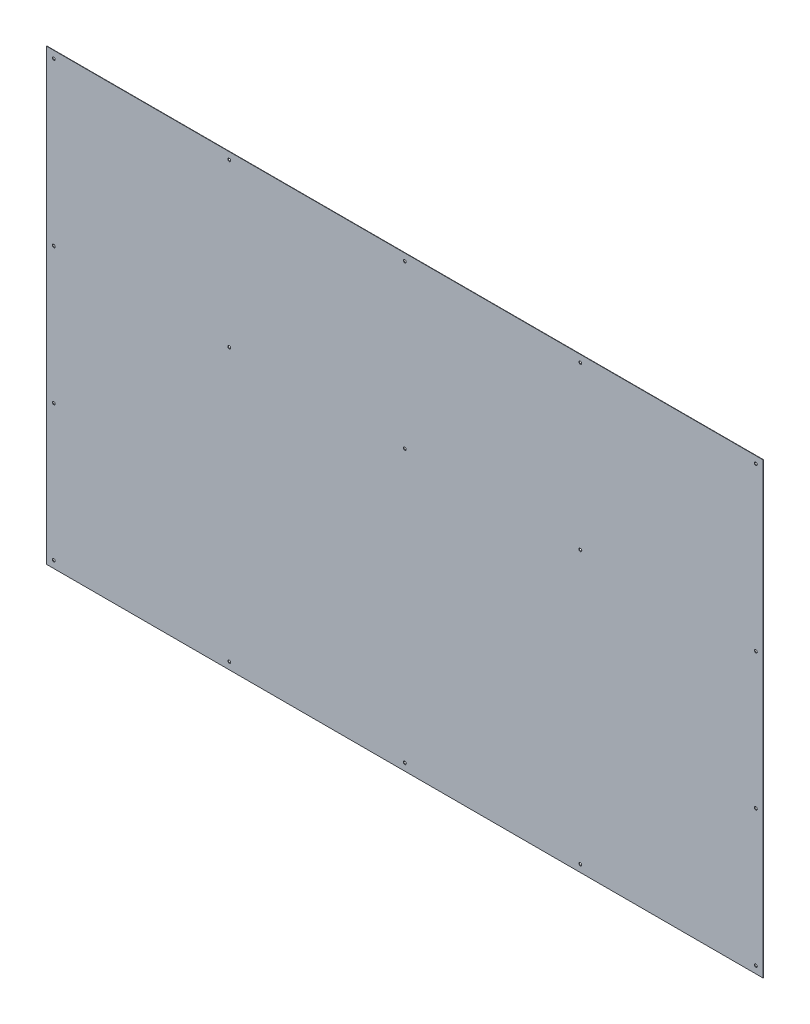
from build123d import *

# Parameters (mm, degrees)
SKETCH1_W           = 2000
SKETCH1_H           = 1253
SKETCH1_R           = 3
BOSS_EXTRUDE1_DEPTH = 1
CHAMFER1_SIZE       = 1


with BuildPart() as part:
    # Sketch1 → Boss-Extrude1 (new body)
    with BuildSketch(Plane.XY):
        Rectangle(SKETCH1_W, SKETCH1_H)
        with Locations((-980, 606.5)):
            Circle(SKETCH1_R, mode=Mode.SUBTRACT)
        with Locations((980, 606.5)):
            Circle(SKETCH1_R, mode=Mode.SUBTRACT)
        with Locations((0, 606.5)):
            Circle(SKETCH1_R, mode=Mode.SUBTRACT)
        with Locations((-980, -606.5)):
            Circle(SKETCH1_R, mode=Mode.SUBTRACT)
        with Locations((980, -606.5)):
            Circle(SKETCH1_R, mode=Mode.SUBTRACT)
        with Locations((0, -606.5)):
            Circle(SKETCH1_R, mode=Mode.SUBTRACT)
        with Locations((-490, -606.5)):
            Circle(SKETCH1_R, mode=Mode.SUBTRACT)
        with Locations((490, -606.5)):
            Circle(SKETCH1_R, mode=Mode.SUBTRACT)
        with Locations((-490, 606.5)):
            Circle(SKETCH1_R, mode=Mode.SUBTRACT)
        with Locations((490, 606.5)):
            Circle(SKETCH1_R, mode=Mode.SUBTRACT)
        with Locations((980, 153.5)):
            Circle(SKETCH1_R, mode=Mode.SUBTRACT)
        with Locations((490, 153.5)):
            Circle(SKETCH1_R, mode=Mode.SUBTRACT)
        with Locations((0, 153.5)):
            Circle(SKETCH1_R, mode=Mode.SUBTRACT)
        with Locations((-490, 153.5)):
            Circle(SKETCH1_R, mode=Mode.SUBTRACT)
        with Locations((-980, 153.5)):
            Circle(SKETCH1_R, mode=Mode.SUBTRACT)
        with Locations((980, -226.5)):
            Circle(SKETCH1_R, mode=Mode.SUBTRACT)
        with Locations((-980, -226.5)):
            Circle(SKETCH1_R, mode=Mode.SUBTRACT)
    extrude(amount=BOSS_EXTRUDE1_DEPTH)

    # Chamfer1
    chamfer1_edges = [part.edges().sort_by_distance(p)[0] for p in [
        (-983, 606.5, 1),
        (977, 606.5, 1),
        (-3, 606.5, 1),
        (-983, -606.5, 1),
        (977, -606.5, 1),
        (-3, -606.5, 1),
        (977, -226.5, 1),
        (-983, -226.5, 1),
        (-493, -606.5, 1),
        (487, -606.5, 1),
        (-493, 606.5, 1),
        (487, 606.5, 1),
        (-983, 153.5, 1),
        (977, 153.5, 1),
        (-3, 153.5, 1),
        (-493, 153.5, 1),
        (487, 153.5, 1),
    ]]
    chamfer(chamfer1_edges, length=CHAMFER1_SIZE - 0.0001)  # a hair under: the kernel refuses the full size


solid = part.part
